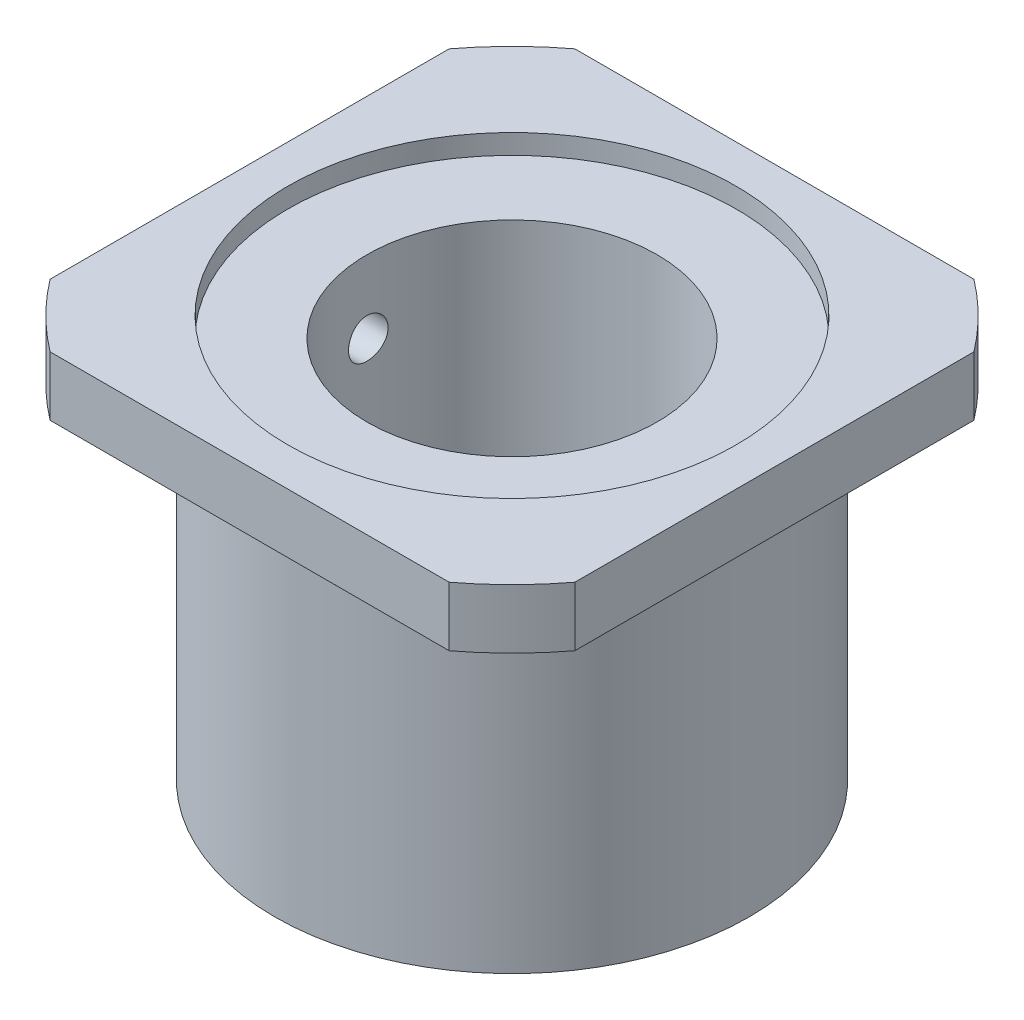
from build123d import *

# Parameters (mm, degrees)
SKETCH1_R              = 25
BOSS_EXTRUDE1_DEPTH    = 50
SKETCH2_R              = 25
SKETCH2_R_2            = 18
CUT_EXTRUDE1_DEPTH     = 46
CUT_EXTRUDE2_START     = -4
CUT_EXTRUDE2_OUTLINE_R = 1.5
CUT_EXTRUDE2_DEPTH     = 4
SKETCH6_R              = 6.5
CUT_EXTRUDE5_DEPTH     = 5
SKETCH8_R              = 11
CUT_EXTRUDE6_DEPTH     = 13
SKETCH9_R              = 11
CUT_EXTRUDE7_DEPTH     = 5
SKETCH10_R             = 4
CUT_EXTRUDE8_DEPTH     = 58.37612744
SKETCH11_R             = 11
SKETCH11_R_2           = 4
CUT_EXTRUDE9_DEPTH     = 27
SKETCH13_R             = 18
SKETCH13_R_2           = 11
CUT_EXTRUDE10_DEPTH    = 18
CUT_EXTRUDE13_START    = -3
CUT_EXTRUDE13_DEPTH    = 3
BOSS_EXTRUDE4_START    = 2
SKETCH19_R             = 1.5
SKETCH19_R_2           = 18
BOSS_EXTRUDE4_DEPTH    = 2
F_3DSKETCH11_R         = 1.5
CUT_EXTRUDE14_DEPTH    = 19.9
SKETCH20_R             = 11
CUT_EXTRUDE15_DEPTH    = 5
SKETCH21_R             = 17
BOSS_EXTRUDE5_DEPTH    = 1.5


with BuildPart() as part:
    # Sketch1 → Boss-Extrude1 (new body)
    with BuildSketch(Plane(origin=(0, 0, 0), x_dir=(1, 0, 0), z_dir=(0, 1, 0))):
        with Locations(Location((0, 0, 0), (0, 0, 270))):
            Circle(SKETCH1_R)
    extrude(amount=BOSS_EXTRUDE1_DEPTH)

    # Sketch2 → Cut-Extrude1 (cut)
    with BuildSketch(Plane.XZ):
        with Locations(Location((0, 0, 0), (0, 0, 90))):
            Circle(SKETCH2_R)
        with Locations(Location((0, 0, 0), (0, 0, 270))):
            Circle(SKETCH2_R_2, mode=Mode.SUBTRACT)
    extrude(amount=-CUT_EXTRUDE1_DEPTH, mode=Mode.SUBTRACT)

    # Cut-Extrude2: read off the stored shape, not the designer's step
    # Cut-Extrude2 outline → Cut-Extrude2 (cut)
    with BuildSketch(Plane(origin=(0, 50, 0), x_dir=(1, 0, 0), z_dir=(0, 1, 0)).offset(CUT_EXTRUDE2_START)):
        with BuildLine():
            ThreePointArc((-15.132415538, -19.9), (0, -25), (15.132415538, -19.9))
            Line((15.132415538, -19.9), (-15.132415538, -19.9))
        make_face()
        with BuildLine():
            Line((19.9, 15.132415538), (19.9, -15.132415538))
            ThreePointArc((19.9, -15.132415538), (25, 0), (19.9, 15.132415538))
        make_face()
        with BuildLine():
            ThreePointArc((-19.9, 15.132415538), (-25, 0), (-19.9, -15.132415538))
            Line((-19.9, -15.132415538), (-19.9, 15.132415538))
        make_face()
        with BuildLine():
            Line((-15.132415538, 19.9), (15.132415538, 19.9))
            ThreePointArc((15.132415538, 19.9), (0, 25), (-15.132415538, 19.9))
        make_face()
        with Locations((-15.132415538, -15.132415538)):
            Circle(CUT_EXTRUDE2_OUTLINE_R)
        with Locations((15.132415538, -15.132415538)):
            Circle(CUT_EXTRUDE2_OUTLINE_R)
        with Locations((-15.132415538, 15.132415538)):
            Circle(CUT_EXTRUDE2_OUTLINE_R)
        with Locations((15.132415538, 15.132415538)):
            Circle(CUT_EXTRUDE2_OUTLINE_R)
    extrude(amount=CUT_EXTRUDE2_DEPTH, mode=Mode.SUBTRACT)

    # Sketch6 → Cut-Extrude5 (cut)
    with BuildSketch(Plane(origin=(0, 50, 0), x_dir=(1, 0, 0), z_dir=(0, 1, 0))):
        with Locations(Location((0, 0, 0), (0, 0, 270))):
            Circle(SKETCH6_R)
    extrude(amount=-CUT_EXTRUDE5_DEPTH, mode=Mode.SUBTRACT)

    # Sketch8 → Cut-Extrude6 (cut)
    with BuildSketch(Plane(origin=(0, 45, 0), x_dir=(1, 0, 0), z_dir=(0, 1, 0))):
        with Locations(Location((0, 0, 0), (0, 0, 270))):
            Circle(SKETCH8_R)
    extrude(amount=-CUT_EXTRUDE6_DEPTH, mode=Mode.SUBTRACT)

    # Sketch9 → Cut-Extrude7 (cut)
    with BuildSketch(Plane(origin=(0, 50, 0), x_dir=(1, 0, 0), z_dir=(0, 1, 0))):
        with Locations(Location((0, 0, 0), (0, 0, 270))):
            Circle(SKETCH9_R)
    extrude(amount=-CUT_EXTRUDE7_DEPTH, mode=Mode.SUBTRACT)

    # Sketch10 → Cut-Extrude8 (cut, through all)
    with BuildSketch(Plane.XZ):
        with Locations(Location((0, 0, 0), (0, 0, 270))):
            Circle(SKETCH10_R)
    extrude(amount=-CUT_EXTRUDE8_DEPTH, mode=Mode.SUBTRACT)

    # Sketch11 → Cut-Extrude9 (cut)
    with BuildSketch(Plane.XZ):
        with Locations(Location((0, 0, 0), (0, 0, 90))):
            Circle(SKETCH11_R)
        with Locations(Location((0, 0, 0), (0, 0, 270))):
            Circle(SKETCH11_R_2, mode=Mode.SUBTRACT)
    extrude(amount=-CUT_EXTRUDE9_DEPTH, mode=Mode.SUBTRACT)

    # Sketch13 → Cut-Extrude10 (cut)
    with BuildSketch(Plane.XZ):
        with Locations(Location((0, 0, 0), (0, 0, 270))):
            Circle(SKETCH13_R)
        with Locations(Location((0, 0, 0), (0, 0, 270))):
            Circle(SKETCH13_R_2, mode=Mode.SUBTRACT)
    extrude(amount=-CUT_EXTRUDE10_DEPTH, mode=Mode.SUBTRACT)

    # Sketch18 → Cut-Extrude13 (cut)
    with BuildSketch(Plane(origin=(0, 50, 0), x_dir=(1, 0, 0), z_dir=(0, 1, 0)).offset(CUT_EXTRUDE13_START)):
        with BuildLine():
            Line((-19.9, 15.132415538), (-19.9, -15.132415538))
            ThreePointArc((-19.9, -15.132415538), (-17.67766953, -17.67766953), (-15.132415538, -19.9))
            Line((-15.132415538, -19.9), (15.132415538, -19.9))
            ThreePointArc((15.132415538, -19.9), (17.67766953, -17.67766953), (19.9, -15.132415538))
            Line((19.9, -15.132415538), (19.9, 15.132415538))
            ThreePointArc((19.9, 15.132415538), (17.67766953, 17.67766953), (15.132415538, 19.9))
            Line((15.132415538, 19.9), (-15.132415538, 19.9))
            ThreePointArc((-15.132415538, 19.9), (-17.67766953, 17.67766953), (-19.9, 15.132415538))
        make_face()
    extrude(amount=CUT_EXTRUDE13_DEPTH, mode=Mode.SUBTRACT)

    # Sketch19 → Boss-Extrude4 (add)
    with BuildSketch(Plane.XZ.offset(-46).offset(BOSS_EXTRUDE4_START)):
        with BuildLine():
            ThreePointArc((-15.132415538, 19.9), (-17.67766953, 17.67766953), (-19.9, 15.132415538))
            Line((-19.9, 15.132415538), (-19.9, -15.132415538))
            ThreePointArc((-19.9, -15.132415538), (-17.67766953, -17.67766953), (-15.132415538, -19.9))
            Line((-15.132415538, -19.9), (15.132415538, -19.9))
            ThreePointArc((15.132415538, -19.9), (17.67766953, -17.67766953), (19.9, -15.132415538))
            Line((19.9, -15.132415538), (19.9, 15.132415538))
            ThreePointArc((19.9, 15.132415538), (17.67766953, 17.67766953), (15.132415538, 19.9))
            Line((15.132415538, 19.9), (-15.132415538, 19.9))
        make_face()
        with Locations(Location((-15.132415538, -15.132415538, 0), (0, 0, 90))):
            Circle(SKETCH19_R, mode=Mode.SUBTRACT)
        with Locations(Location((-15.132415538, 15.132415538, 0), (0, 0, 90))):
            Circle(SKETCH19_R, mode=Mode.SUBTRACT)
        with Locations(Location((0, 0, 0), (0, 0, 270))):
            Circle(SKETCH19_R_2, mode=Mode.SUBTRACT)
        with Locations(Location((15.132415538, 15.132415538, 0), (0, 0, 90))):
            Circle(SKETCH19_R, mode=Mode.SUBTRACT)
        with Locations(Location((15.132415538, -15.132415538, 0), (0, 0, 90))):
            Circle(SKETCH19_R, mode=Mode.SUBTRACT)
    extrude(amount=-BOSS_EXTRUDE4_DEPTH)

    # 3DSketch11 → Cut-Extrude14 (cut)
    with BuildSketch(Plane(origin=(0, 44, 0), x_dir=(0, -1, 0), z_dir=(-1, 0, 0))):
        with Locations(Location((2.5, 0, 0), (0, 0, 90))):
            Circle(F_3DSKETCH11_R)
    extrude(amount=CUT_EXTRUDE14_DEPTH, mode=Mode.SUBTRACT)

    # Sketch20 → Cut-Extrude15 (cut)
    with BuildSketch(Plane.XZ.offset(-27)):
        with Locations(Location((0, 0, 0), (0, 0, 270))):
            Circle(SKETCH20_R)
    extrude(amount=-CUT_EXTRUDE15_DEPTH, mode=Mode.SUBTRACT)

    # Sketch21 → Boss-Extrude5 (add)
    with BuildSketch(Plane(origin=(0, 47, 0), x_dir=(1, 0, 0), z_dir=(0, 1, 0))):
        with BuildLine():
            Line((-19.9, 15.132415538), (-19.9, -15.132415538))
            ThreePointArc((-19.9, -15.132415538), (-17.67766953, -17.67766953), (-15.132415538, -19.9))
            Line((-15.132415538, -19.9), (15.132415538, -19.9))
            ThreePointArc((15.132415538, -19.9), (17.67766953, -17.67766953), (19.9, -15.132415538))
            Line((19.9, -15.132415538), (19.9, 15.132415538))
            ThreePointArc((19.9, 15.132415538), (17.67766953, 17.67766953), (15.132415538, 19.9))
            Line((15.132415538, 19.9), (-15.132415538, 19.9))
            ThreePointArc((-15.132415538, 19.9), (-17.67766953, 17.67766953), (-19.9, 15.132415538))
        make_face()
        with Locations(Location((0, 0, 0), (0, 0, 270))):
            Circle(SKETCH21_R, mode=Mode.SUBTRACT)
    extrude(amount=BOSS_EXTRUDE5_DEPTH)


solid = part.part
